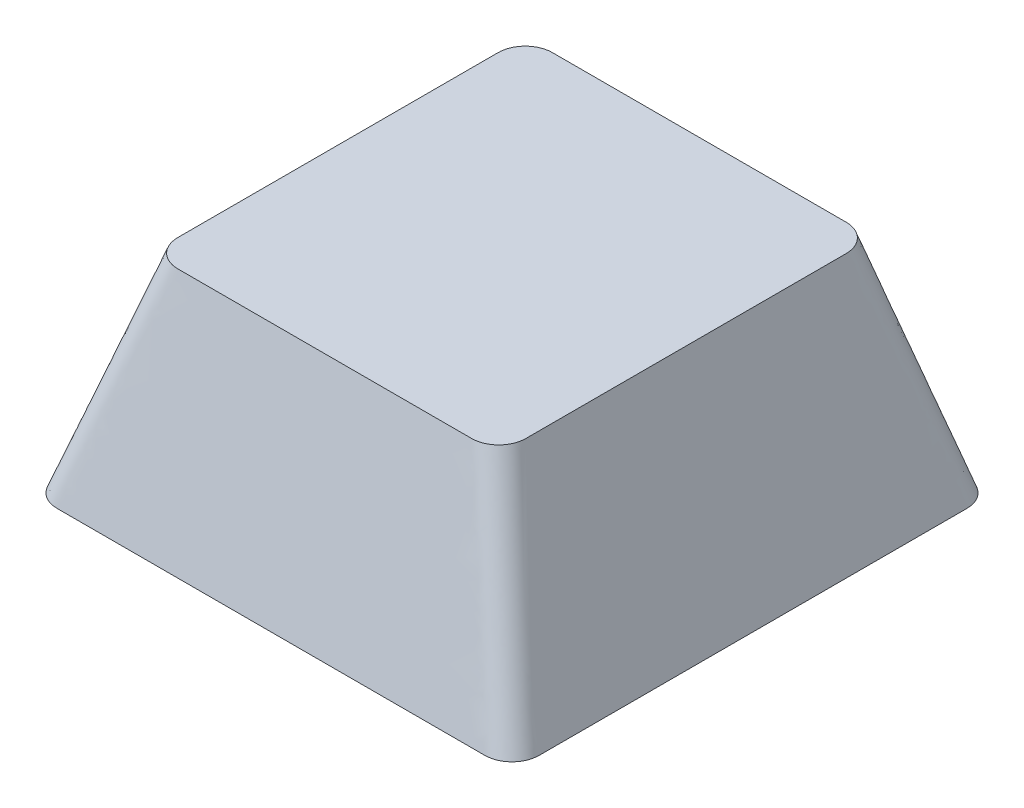
from build123d import *


with BuildPart() as part:
    # Croquis3 for Recubrir1 → Recubrir1 section 0
    with BuildSketch(Plane(origin=(0, 8.001, 0), x_dir=(1, 0, 0), z_dir=(0, 1, 0))):
        with BuildLine():
            Line((-5.4864, -6.9977), (5.4864, -6.9977))
            # circular arc as an exact rational Bezier (weights 1, cos(half-angle), 1)
            Bezier((5.4864, -6.9977), (6.5024, -6.9977), (6.5024, -5.9817), weights=[1, 0.707106781, 1])
            Line((6.5024, -5.9817), (6.5024, 5.9817))
            Bezier((6.5024, 5.9817), (6.5024, 6.9977), (5.4864, 6.9977), weights=[1, 0.707106781, 1])
            Line((5.4864, 6.9977), (-5.4864, 6.9977))
            Bezier((-5.4864, 6.9977), (-6.5024, 6.9977), (-6.5024, 5.9817), weights=[1, 0.707106781, 1])
            Line((-6.5024, 5.9817), (-6.5024, -5.9817))
            Bezier((-6.5024, -5.9817), (-6.5024, -6.9977), (-5.4864, -6.9977), weights=[1, 0.707106781, 1])
        make_face()
    # Croquis2 for Recubrir1 → Recubrir1 section 1
    with BuildSketch(Plane(origin=(0, 0, 0), x_dir=(1, 0, 0), z_dir=(0, 1, 0))):
        with BuildLine():
            Line((-7.9883, -9.0043), (7.9883, -9.0043))
            Bezier((7.9883, -9.0043), (9.0043, -9.0043), (9.0043, -7.9883), weights=[1, 0.707106781, 1])
            Line((9.0043, -7.9883), (9.0043, 7.9883))
            Bezier((9.0043, 7.9883), (9.0043, 9.0043), (7.9883, 9.0043), weights=[1, 0.707106781, 1])
            Line((7.9883, 9.0043), (-7.9883, 9.0043))
            Bezier((-7.9883, 9.0043), (-9.0043, 9.0043), (-9.0043, 7.9883), weights=[1, 0.707106781, 1])
            Line((-9.0043, 7.9883), (-9.0043, -7.9883))
            Bezier((-9.0043, -7.9883), (-9.0043, -9.0043), (-7.9883, -9.0043), weights=[1, 0.707106781, 1])
        make_face()
    loft()


solid = part.part
